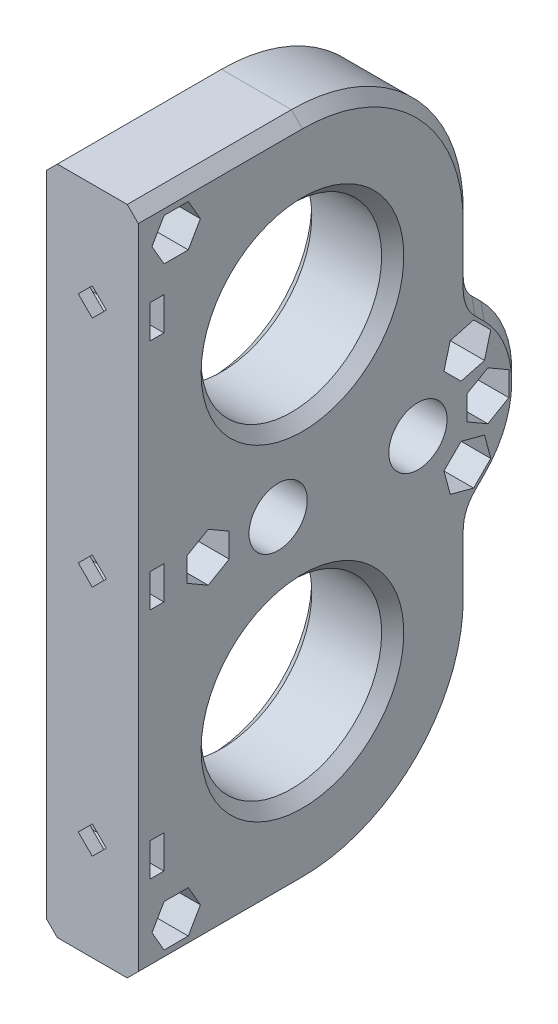
from build123d import *
from build123d.topology import SkipClean

# Parameters (mm, degrees)
BOSS_EXTRUDE1_DEPTH     = 8
CUT_EXTRUDE1_DEPTH      = 78.289612463
CUT_EXTRUDE1_DEPTH_BACK = 70.289612463
CUT_EXTRUDE1_START      = -8
SKETCH9_R               = 5
CUT_EXTRUDE2_DEPTH      = 70.289612463
CUT_EXTRUDE2_DEPTH_BACK = 70.289612463
CUT_EXTRUDE3_DEPTH      = 70.289612463
CUT_EXTRUDE3_DEPTH_BACK = 70.289612463
SKETCH11_R              = 15.5
CUT_EXTRUDE4_DEPTH      = 70.289612463
CUT_EXTRUDE4_DEPTH_BACK = 70.289612463
SKETCH12_W              = 5.7
SKETCH12_H              = 2.4
CUT_EXTRUDE5_START      = 28.174078
CUT_EXTRUDE5_DEPTH      = 6
CHAMFER1_SIZE           = 2
MOVE_START              = -8
MOVE_FACE1_OUTLINE_W    = 59
MOVE_FACE1_OUTLINE_H    = 67
MOVE_FACE1_DEPTH        = 0.1
MOVE_START_2            = 7.9
MOVE_FACE1_2_OUTLINE_W  = 59
MOVE_FACE1_2_OUTLINE_H  = 67
MOVE_FACE1_2_DEPTH      = 0.1


# Read off the part's stored shape, not the designer's step: Move Face1
with BuildPart() as part:
    # Sketch2 → Boss-Extrude1 (new, symmetric)
    with BuildSketch(Plane.YZ):
        with BuildLine():
            Line((-12.727922061, -32.553844327), (-14.317300295, -30.964466094))
            ThreePointArc((-14.317300295, -30.964466094), (-15.939417039, -29.880602337), (-17.852834201, -29.5))
            Line((-17.852834201, -29.5), (-28, -29.5))
            ThreePointArc((-28, -29.5), (-48.859650045, -20.859650045), (-57.5, 0))
            Line((-57.5, 0), (-57.5, 28.174077734))
            Line((-57.5, 28.174077734), (0, 28.174077734))
            Line((0, 28.174077734), (0, -37.825922266))
            ThreePointArc((0, -37.825922266), (-6.888301783, -36.455753851), (-12.727922061, -32.553844327))
        make_face()
    extrude(amount=BOSS_EXTRUDE1_DEPTH, both=True)

    # Sketch9 → Cut-Extrude1 (cut, two sides: drawn at the far end of the back side and taken through both)
    with BuildSketch(Plane.YZ.offset(CUT_EXTRUDE1_START - CUT_EXTRUDE1_DEPTH_BACK)):
        with Locations((0, 4.174077734)):
            Circle(SKETCH9_R)
        with Locations((0, -19.825922266)):
            Circle(SKETCH9_R)
    extrude(amount=CUT_EXTRUDE1_DEPTH + CUT_EXTRUDE1_DEPTH_BACK, mode=Mode.SUBTRACT)

    # Sketch10 → Cut-Extrude2 (cut, two sides: drawn at the far end of the back side and taken through both)
    with BuildSketch(Plane.YZ.offset(-CUT_EXTRUDE2_DEPTH_BACK)):
        Polygon((2.078460969, 12.574077734), (4.156921938, 16.174077734), (2.078460969, 19.774077734), (-2.078460969, 19.774077734), (-4.156921938, 16.174077734), (-2.078460969, 12.574077734), align=None)
        Polygon((-5.545893683, -31.250591332), (-4.470003116, -27.235313074), (-7.409390808, -24.295925382), (-11.424669066, -25.371815949), (-12.500559632, -29.387094207), (-9.561171941, -32.326481898), align=None)
        Polygon((4.156921938, -31.825922266), (2.078460969, -28.225922266), (-2.078460969, -28.225922266), (-4.156921938, -31.825922266), (-2.078460969, -35.425922266), (2.078460969, -35.425922266), align=None)
        Polygon((12.500559632, -29.387094207), (11.424669066, -25.371815949), (7.409390808, -24.295925382), (4.470003116, -27.235313074), (5.545893683, -31.250591332), (9.561171941, -32.326481898), align=None)
        Polygon((-51, 17.517155796), (-47.4, 19.595616765), (-47.4, 23.752538703), (-51, 25.830999672), (-54.6, 23.752538703), (-54.6, 19.595616765), align=None)
    extrude(amount=CUT_EXTRUDE2_DEPTH + CUT_EXTRUDE2_DEPTH_BACK, mode=Mode.SUBTRACT)

    # Sketch11 → Cut-Extrude3 (cut, two sides: drawn at the far end of the back side and taken through both)
    with BuildSketch(Plane.YZ.offset(-CUT_EXTRUDE3_DEPTH_BACK)):
        with Locations(Location((-28, 0, 0), (0, 0, 270))):
            Circle(SKETCH11_R)
    extrude(amount=CUT_EXTRUDE3_DEPTH + CUT_EXTRUDE3_DEPTH_BACK, mode=Mode.SUBTRACT)

    # Sketch12 → Cut-Extrude4 (cut, two sides: drawn at the far end of the back side and taken through both)
    with BuildSketch(Plane.YZ.offset(-CUT_EXTRUDE4_DEPTH_BACK)):
        with Locations((-40, 24.974077734)):
            Rectangle(SKETCH12_W, SKETCH12_H)
        with Locations((0, 24.974077734)):
            Rectangle(SKETCH12_W, SKETCH12_H)
    extrude(amount=CUT_EXTRUDE4_DEPTH + CUT_EXTRUDE4_DEPTH_BACK, mode=Mode.SUBTRACT)

    # Sketch13 → Cut-Extrude5 (cut)
    with BuildSketch(Plane.XY.offset(CUT_EXTRUDE5_START)):
        Polygon((0, -2.404163056), (2.404163056, 0), (0, 2.404163056), (-2.404163056, 0), align=None)
        Polygon((0, -42.404163056), (2.404163056, -40), (0, -37.595836944), (-2.404163056, -40), align=None)
    extrude(amount=-CUT_EXTRUDE5_DEPTH, mode=Mode.SUBTRACT)

    # Chamfer1
    chamfer1_edges = [part.edges().sort_by_distance(p)[0] for p in [
        (8, -22.9264171, -29.5),
        (8, -48.859650045, -20.859650045),
        (8, -57.5, 14.087038867),
        (-8, -48.859650045, -20.859650045),
        (-8, -28, 15.5),
        (8, -28, 15.5),
        (-8, -22.9264171, -29.5),
        (-8, -15.939417039, -29.880602337),
        (-8, -13.522611178, -31.759155211),
        (-8, -6.888301783, -36.455753851),
        (-8, -57.5, 14.087038867),
        (8, -6.888301783, -36.455753851),
        (8, -13.522611178, -31.759155211),
        (8, -15.939417039, -29.880602337),
    ]]
    chamfer(chamfer1_edges, length=CHAMFER1_SIZE)

    # Move Face1 outline → Move Face1 (cut)
    with BuildSketch(Plane.YZ.offset(MOVE_START)):
        with Locations((-27.5, -3.5)):
            Rectangle(MOVE_FACE1_OUTLINE_W, MOVE_FACE1_OUTLINE_H)
    extrude(amount=MOVE_FACE1_DEPTH, mode=Mode.SUBTRACT)

    # Move Face1 2 outline → Move Face1 2 (cut)
    with BuildSketch(Plane.YZ.offset(MOVE_START_2)):
        with Locations((-27.5, -3.5)):
            Rectangle(MOVE_FACE1_2_OUTLINE_W, MOVE_FACE1_2_OUTLINE_H)
    extrude(amount=MOVE_FACE1_2_DEPTH, mode=Mode.SUBTRACT)

    # Mirror1: part across plane


with BuildPart() as part_1:
    with SkipClean():  # the faces are left unmerged after this step: merging them gives an invalid solid
        add(part.part)
        add(part.part.mirror(Plane(origin=(0, 0, 0), x_dir=(0, 0, 1), z_dir=(0, -1, 0))))


solid = part_1.part
